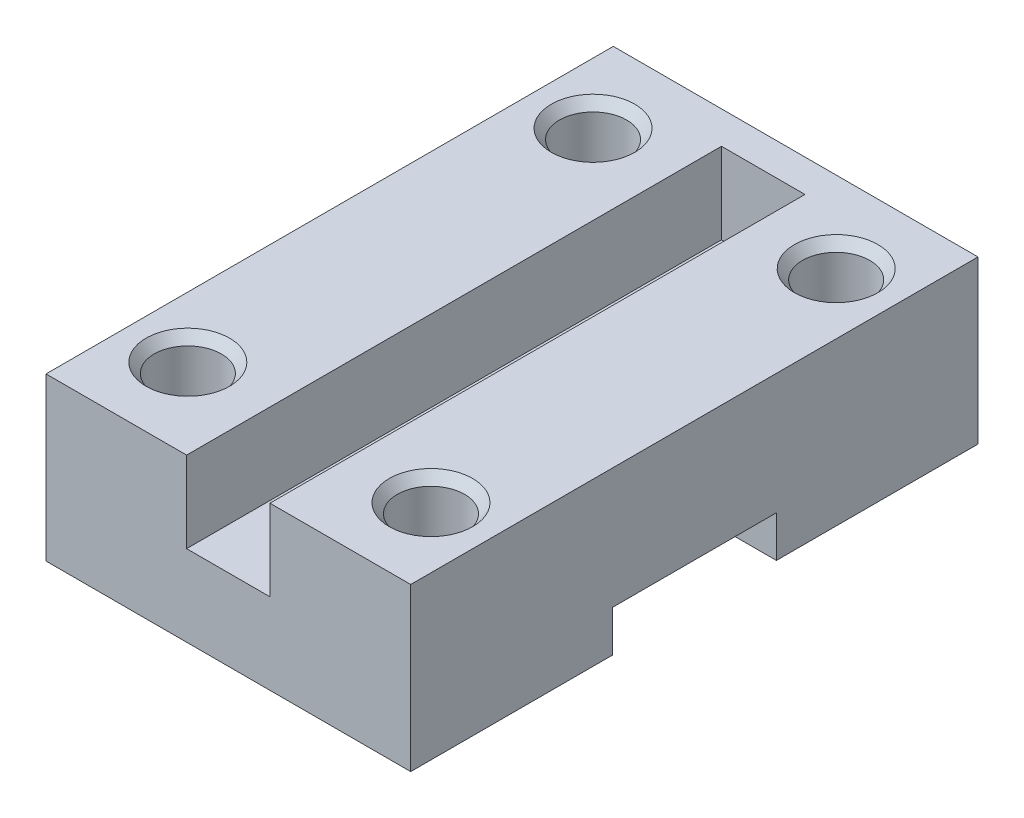
from build123d import *

# Parameters (mm, degrees)
SKETCH1_W               = 45
SKETCH1_H               = 70
BOSS_EXTRUDE1_DEPTH     = 10
CUT_EXTRUDE1_DEPTH      = 58.879184514
CUT_EXTRUDE1_DEPTH_BACK = 58.879184514
SKETCH2_W               = 20.25
SKETCH2_H               = 5.1
SKETCH3_R               = 4.15
CUT_EXTRUDE2_DEPTH      = 43.793106922
SKETCH5_R               = 4.15
BOSS_EXTRUDE2_DEPTH     = 10
CHAMFER1_SIZE           = 1
CHAMFER1_SIZE2          = 1.191753593


with BuildPart() as part:
    # Sketch1 → Boss-Extrude1 (new body)
    with BuildSketch(Plane(origin=(0, 0, 0), x_dir=(1, 0, 0), z_dir=(0, 1, 0))):
        Rectangle(SKETCH1_W, SKETCH1_H)
    extrude(amount=BOSS_EXTRUDE1_DEPTH)

    # Sketch2 → Cut-Extrude1 (cut, two sides: drawn at the far end of the back side and taken through both)
    with BuildSketch(Plane(origin=(22.5, 0, 0), x_dir=(0, 0, -1), z_dir=(1, 0, 0)).offset(-CUT_EXTRUDE1_DEPTH_BACK)):
        with Locations((0, 2.55)):
            Rectangle(SKETCH2_W, SKETCH2_H)
    extrude(amount=CUT_EXTRUDE1_DEPTH + CUT_EXTRUDE1_DEPTH_BACK, mode=Mode.SUBTRACT)

    # Sketch3 → Cut-Extrude2 (cut, through all)
    with BuildSketch(Plane.XZ):
        with Locations((15, 25)):
            Circle(SKETCH3_R)
        with Locations((15, -25)):
            Circle(SKETCH3_R)
        with Locations((-15, -25)):
            Circle(SKETCH3_R)
        with Locations((-15, 25)):
            Circle(SKETCH3_R)
    extrude(amount=-CUT_EXTRUDE2_DEPTH, mode=Mode.SUBTRACT)

    # Sketch5 → Boss-Extrude2 (add)
    with BuildSketch(Plane(origin=(0, 10, 0), x_dir=(1, 0, 0), z_dir=(0, 1, 0))):
        Polygon((-5.15, -35), (-22.5, -35), (-22.5, 35), (22.5, 35), (22.5, -35), (5.15, -35), (5.130229348, -34.949305848), (5.15, 31), (-5.15, 31), align=None)
        with Locations((-15, 25)):
            Circle(SKETCH5_R, mode=Mode.SUBTRACT)
        with Locations((15, 25)):
            Circle(SKETCH5_R, mode=Mode.SUBTRACT)
        with Locations((15, -25)):
            Circle(SKETCH5_R, mode=Mode.SUBTRACT)
        with Locations((-15, -25)):
            Circle(SKETCH5_R, mode=Mode.SUBTRACT)
    extrude(amount=BOSS_EXTRUDE2_DEPTH)

    # Chamfer1
    chamfer1_edges = [part.edges().sort_by_distance(p)[0] for p in [
        (10.85, 20, 25),
        (-19.15, 20, 25),
        (-19.15, 20, -25),
        (10.85, 20, -25),
    ]]
    chamfer1_side = [part.faces().sort_by_distance(p)[0] for p in [
        (-13.825, 20, 34.167834151),
    ]]
    chamfer(chamfer1_edges, length=CHAMFER1_SIZE, length2=CHAMFER1_SIZE2, reference=chamfer1_side[0])


solid = part.part
